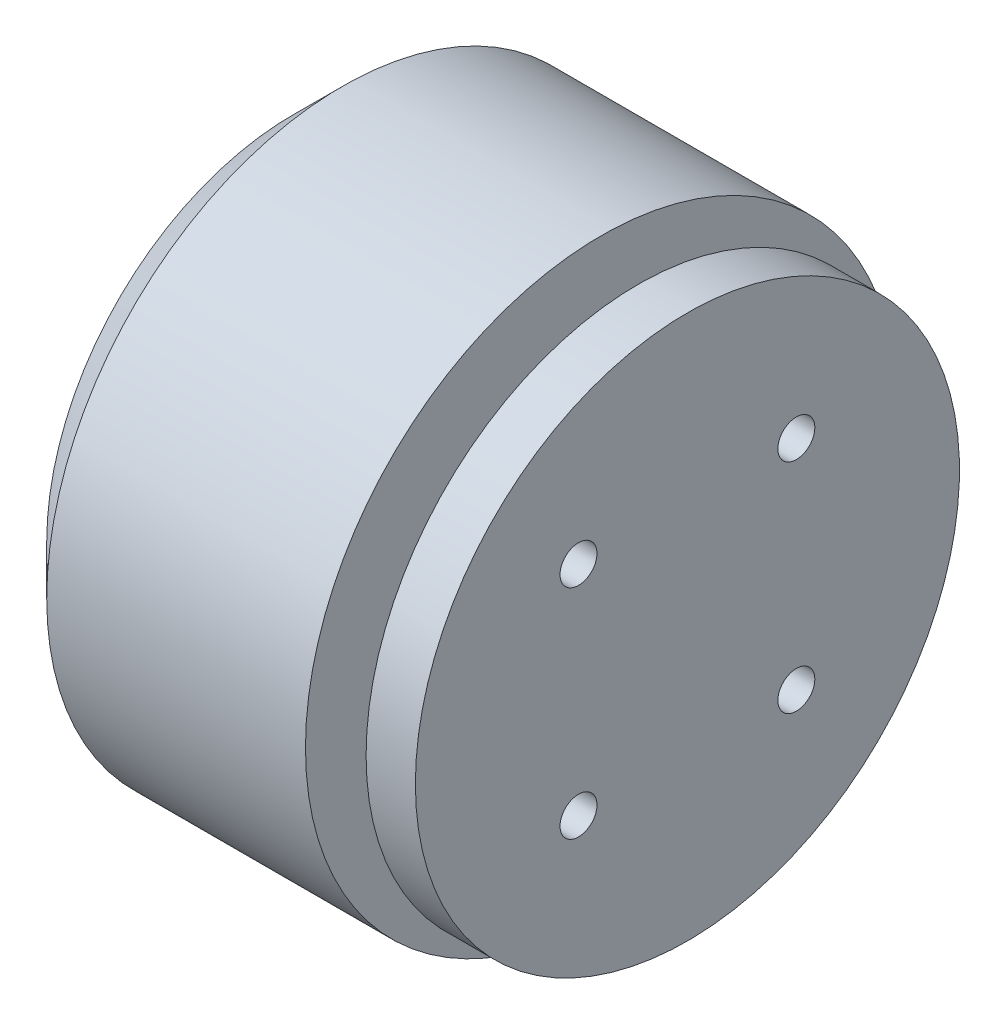
from build123d import *

# Parameters (mm, degrees)
SKETCH2_R          = 1.5
CUT_EXTRUDE1_DEPTH = 3.3
SKETCH3_R          = 1.5
CUT_EXTRUDE2_DEPTH = 8


with BuildPart() as part:
    # Sketch1 → Revolve1 (revolve)
    with BuildSketch(Plane.XY):
        Polygon((0, 0), (0, 22.08), (-4, 22.08), (-4, 16.8), (-7, 16.8), (-7, 24), (-28, 24), (-32, 20), (-32, 2), (-44, 2), (-44, 0), align=None)
    revolve(axis=Axis((-10, 0, 0), (1, 0, 0)))

    # Sketch2 → Cut-Extrude1 (cut)
    with BuildSketch(Plane(origin=(0, 0, 0), x_dir=(0, 0, -1), z_dir=(1, 0, 0))):
        with Locations((-8.84, 8.84)):
            Circle(SKETCH2_R)
        with Locations((-8.84, -8.84)):
            Circle(SKETCH2_R)
        with Locations((8.84, 8.84)):
            Circle(SKETCH2_R)
        with Locations((8.84, -8.84)):
            Circle(SKETCH2_R)
    extrude(amount=-CUT_EXTRUDE1_DEPTH, mode=Mode.SUBTRACT)

    # Sketch3 → Cut-Extrude2 (cut)
    with BuildSketch(Plane(origin=(-32, 0, 0), x_dir=(0, 0, -1), z_dir=(1, 0, 0))):
        with Locations((-6, 0)):
            Circle(SKETCH3_R)
        with Locations((6, 0)):
            Circle(SKETCH3_R)
        with Locations((0, 6)):
            Circle(SKETCH3_R)
        with Locations((0, -6)):
            Circle(SKETCH3_R)
    extrude(amount=CUT_EXTRUDE2_DEPTH, mode=Mode.SUBTRACT)


solid = part.part
